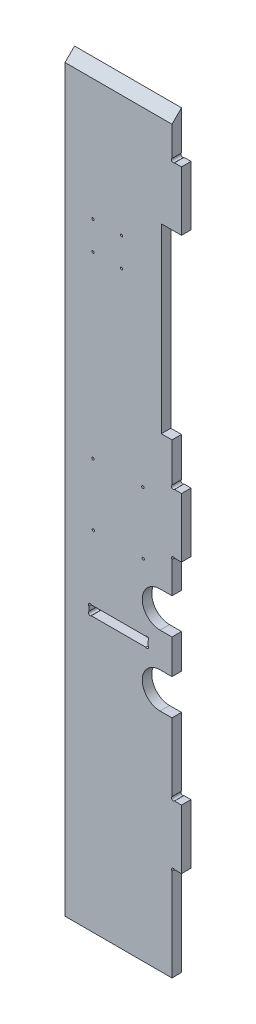
from build123d import *

# Parameters (mm, degrees)
ESQUISSE1_R        = 1
BOSS_EXTRU_1_DEPTH = 8
CHANFREIN1_SIZE    = 8


with BuildPart() as part:
    # Esquisse1 → Boss.-Extru.1 (new body)
    with BuildSketch(Plane.XY):
        with BuildLine():
            Line((5.879855223, 335.703540816), (5.879855223, 368.656410216))
            Line((5.879855223, 368.656410216), (-3.120144777, 368.656410216))
            Line((-3.120144777, 368.656410216), (-3.120144777, 521.656410212))
            Line((-3.120144777, 521.656410212), (13.879855223, 521.656410212))
            Line((13.879855223, 521.656410212), (13.879855223, 571.582220472))
            Line((13.879855223, 571.582220472), (8.001175566, 571.582220472))
            ThreePointArc((8.001175566, 571.582220472), (5.879855223, 571.582220472), (5.879855223, 573.703540816))
            Line((5.879855223, 573.703540816), (5.879855223, 596.798102411))
            Line((5.879855223, 596.798102411), (5.879855223, 606.656410212))
            Line((5.879855223, 606.656410212), (-84.120144777, 606.656410212))
            Line((-84.120144777, 606.656410212), (-84.120144777, 596.798102411))
            Line((-84.120144777, 596.798102411), (-84.120144777, -23.417779528))
            Line((-84.120144777, -23.417779528), (5.879855223, -23.417779528))
            Line((5.879855223, -23.417779528), (5.879855223, 54.460900128))
            ThreePointArc((5.879855223, 54.460900128), (5.879855223, 56.582220472), (8.001175566, 56.582220472))
            Line((8.001175566, 56.582220472), (13.879855223, 56.582220472))
            Line((13.879855223, 56.582220472), (13.879855223, 106.582220472))
            Line((13.879855223, 106.582220472), (8.001175566, 106.582220472))
            ThreePointArc((8.001175566, 106.582220472), (5.879855223, 106.582220472), (5.879855223, 108.703540816))
            Line((5.879855223, 108.703540816), (5.879855223, 166.119071534))
            Line((5.879855223, 166.119071534), (-4.120144777, 166.119071534))
            ThreePointArc((-4.120144777, 166.119071534), (-19.120144777, 181.119071534), (-4.120144777, 196.119071534))
            Line((-4.120144777, 196.119071534), (5.879855223, 196.119071534))
            Line((5.879855223, 196.119071534), (5.879855223, 225.04536941))
            Line((5.879855223, 225.04536941), (-4.120144777, 225.04536941))
            ThreePointArc((-4.120144777, 225.04536941), (-19.120144777, 240.04536941), (-4.120144777, 255.04536941))
            Line((-4.120144777, 255.04536941), (5.879855223, 255.04536941))
            Line((5.879855223, 255.04536941), (5.879855223, 281.460900128))
            ThreePointArc((5.879855223, 281.460900128), (5.879855223, 283.582220472), (8.001175566, 283.582220472))
            Line((8.001175566, 283.582220472), (13.879855223, 283.582220472))
            Line((13.879855223, 283.582220472), (13.879855223, 333.582220472))
            Line((13.879855223, 333.582220472), (8.001175566, 333.582220472))
            ThreePointArc((8.001175566, 333.582220472), (5.879855223, 333.582220472), (5.879855223, 335.703540816))
        make_face()
        with Locations((-60.550144777, 496.30133456)):
            Circle(ESQUISSE1_R, mode=Mode.SUBTRACT)
        with Locations((-36.550144777, 496.30133456)):
            Circle(ESQUISSE1_R, mode=Mode.SUBTRACT)
        with Locations((-60.550144777, 472.30133456)):
            Circle(ESQUISSE1_R, mode=Mode.SUBTRACT)
        with Locations((-36.550144777, 472.30133456)):
            Circle(ESQUISSE1_R, mode=Mode.SUBTRACT)
        with Locations((-60.593593351, 321.744120307)):
            Circle(ESQUISSE1_R, mode=Mode.SUBTRACT)
        with Locations((-18.595445866, 321.995534365)):
            Circle(ESQUISSE1_R, mode=Mode.SUBTRACT)
        with Locations((-18.28416987, 269.997586055)):
            Circle(ESQUISSE1_R, mode=Mode.SUBTRACT)
        with Locations((-60.282317355, 269.746171996)):
            Circle(ESQUISSE1_R, mode=Mode.SUBTRACT)
        with BuildLine():
            Line((-61.998824434, 214.582220472), (-16.241465121, 214.582220472))
            ThreePointArc((-16.241465121, 214.582220472), (-14.120144777, 214.582220472), (-14.120144777, 212.460900128))
            Line((-14.120144777, 212.460900128), (-14.120144777, 208.703540816))
            ThreePointArc((-14.120144777, 208.703540816), (-14.120144777, 206.582220472), (-16.241465121, 206.582220472))
            Line((-16.241465121, 206.582220472), (-61.998824434, 206.582220472))
            ThreePointArc((-61.998824434, 206.582220472), (-64.120144777, 206.582220472), (-64.120144777, 208.703540816))
            Line((-64.120144777, 208.703540816), (-64.120144777, 212.460900128))
            ThreePointArc((-64.120144777, 212.460900128), (-64.120144777, 214.582220472), (-61.998824434, 214.582220472))
        make_face(mode=Mode.SUBTRACT)
    extrude(amount=BOSS_EXTRU_1_DEPTH)

    # Chanfrein1
    chanfrein1_edges = [part.edges().sort_by_distance(p)[0] for p in [
        (-39.120144777, 606.656410212, 8),
    ]]
    chamfer(chanfrein1_edges, length=CHANFREIN1_SIZE - 0.0001)  # a hair under: the kernel refuses the full size


solid = part.part
